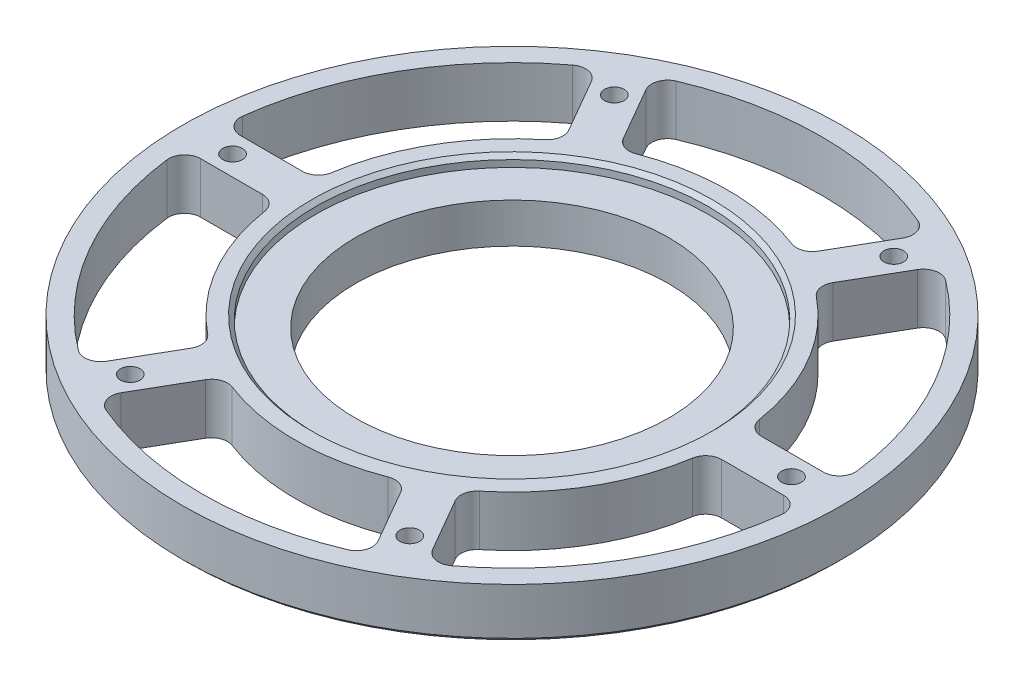
from build123d import *

# Parameters (mm, degrees)
F_10_0_1935_DIAMETER_HOLE1_D = 4.9149
CIRPATTERN3_COUNT            = 6
CUT_EXTRUDE1_DEPTH           = 118.43208675655899
FILLET1_R                    = 4
CIRPATTERN4_COUNT            = 6
FILLET1_OF_CIRPATTERN4_R     = 4
CHAMFER1_SIZE                = 1
CHAMFER2_SIZE                = 1


with BuildPart() as part:
    # Sketch2 → Revolve1 (revolve)
    with BuildSketch(Plane(origin=(0, 0, 0), x_dir=(0, 0, -1), z_dir=(1, 0, 0))):
        Polygon((-39.2125, -8.7e-16), (-82.55, -5.31e-15), (-82.55, 12.699999999999994), (-49.2125, 12.699999999999994), (-49.21250000000001, 9.999999999999998), (-39.21250000000001, 9.999999999999998), align=None)
    revolve(axis=Axis((0, -0.6350000000000053, 0), (0, 1, 0)))

    # #10 (0.1935) Diameter Hole1 (through all)
    with Locations(Plane(origin=(0, 12.699999999999994, 0), x_dir=(1, 0, 0), z_dir=(0, 1, 0))):
        with Locations((-35, 60.621778265)):
            f_10_0_1935_diameter_hole1 = Hole(F_10_0_1935_DIAMETER_HOLE1_D / 2)

    # CirPattern3: #10 (0.1935) Diameter Hole1 ×6 about axis
    cirpattern3_axis = Axis((0, -0.6350000000000053, 0), (0, 1, 0))
    for i in range(1, CIRPATTERN3_COUNT):
        add(f_10_0_1935_diameter_hole1.rotate(cirpattern3_axis, i * 360 / CIRPATTERN3_COUNT), mode=Mode.SUBTRACT)

    # Sketch8 → Cut-Extrude1 (cut, through all)
    with BuildSketch(Plane(origin=(0, 12.699999999999994, 0), x_dir=(1, 0, 0), z_dir=(0, 1, 0))):
        with BuildLine():
            Line((-34.36419588509058, 69.52053323422601), (-22.660589701137393, 49.249292691841845))
            ThreePointArc((-22.660589701137393, 49.249292691841845), (3.32e-15, 54.212500000000006), (22.660589701137393, 49.249292691841845))
            Line((22.660589701137393, 49.249292691841845), (34.36419588509058, 69.52053323422601))
            ThreePointArc((34.36419588509058, 69.52053323422601), (4.75e-15, 77.55), (-34.36419588509058, 69.52053323422601))
        make_face()
    cut_extrude1 = extrude(amount=-CUT_EXTRUDE1_DEPTH, mode=Mode.SUBTRACT)

    # Fillet1
    fillet1_edges = [part.edges().sort_by_distance(p)[0] for p in [
        (34.36419588509058, 6.349999999999996, -69.52053323422601),
        (22.660589701137397, 6.349999999999996, -49.249292691841845),
        (-34.36419588509059, 6.349999999999996, -69.52053323422601),
        (-22.660589701137393, 6.349999999999996, -49.249292691841845),
    ]]
    fillet(fillet1_edges, radius=FILLET1_R)

    # CirPattern4: Cut-Extrude1 ×6 about axis
    cirpattern4_axis = Axis((0, -0.6350000000000053, 0), (0, 1, 0))
    for i in range(1, CIRPATTERN4_COUNT):
        add(cut_extrude1.rotate(cirpattern4_axis, i * 360 / CIRPATTERN4_COUNT), mode=Mode.SUBTRACT)

    # Fillet1 of CirPattern4
    fillet1_of_cirpattern4_edges = [part.edges().sort_by_distance(p)[0] for p in [
        (-43.024449922934764, 6.349999999999996, -64.52053323422612),
        (-31.320843738981637, 6.349999999999996, -44.24929269184193),
        (-77.38864580802536, 6.349999999999996, -4.99999999999989),
        (-53.981433440119034, 6.349999999999996, -4.999999999999929),
        (-77.38864580802536, 6.349999999999996, 4.999999999999872),
        (-53.981433440119034, 6.349999999999996, 4.999999999999904),
        (-43.02444992293478, 6.349999999999996, 64.52053323422612),
        (-31.32084373898165, 6.349999999999996, 44.249292691841916),
        (-34.36419588509059, 6.349999999999996, 69.52053323422601),
        (-22.660589701137404, 6.349999999999996, 49.249292691841845),
        (34.36419588509058, 6.349999999999996, 69.52053323422601),
        (22.660589701137386, 6.349999999999996, 49.249292691841845),
        (43.02444992293474, 6.349999999999996, 64.52053323422614),
        (31.320843738981612, 6.349999999999996, 44.249292691841944),
        (77.38864580802536, 6.349999999999996, 4.999999999999922),
        (53.98143344011903, 6.349999999999996, 4.999999999999947),
        (77.38864580802536, 6.349999999999996, -4.999999999999897),
        (53.981433440119034, 6.349999999999996, -4.999999999999925),
        (43.024449922934764, 6.349999999999996, -64.52053323422614),
        (31.320843738981637, 6.349999999999996, -44.24929269184193),
    ]]
    fillet(fillet1_of_cirpattern4_edges, radius=FILLET1_OF_CIRPATTERN4_R)

    # Chamfer1
    chamfer1_edges = [part.edges().sort_by_distance(p)[0] for p in [
        (6.03e-15, 12.699999999999994, -49.2125),
    ]]
    chamfer(chamfer1_edges, length=CHAMFER1_SIZE)

    # Chamfer2
    chamfer2_edges = [part.edges().sort_by_distance(p)[0] for p in [
        (4.677e-14, -5.33e-15, -82.55),
    ]]
    chamfer(chamfer2_edges, length=CHAMFER2_SIZE)


solid = part.part
